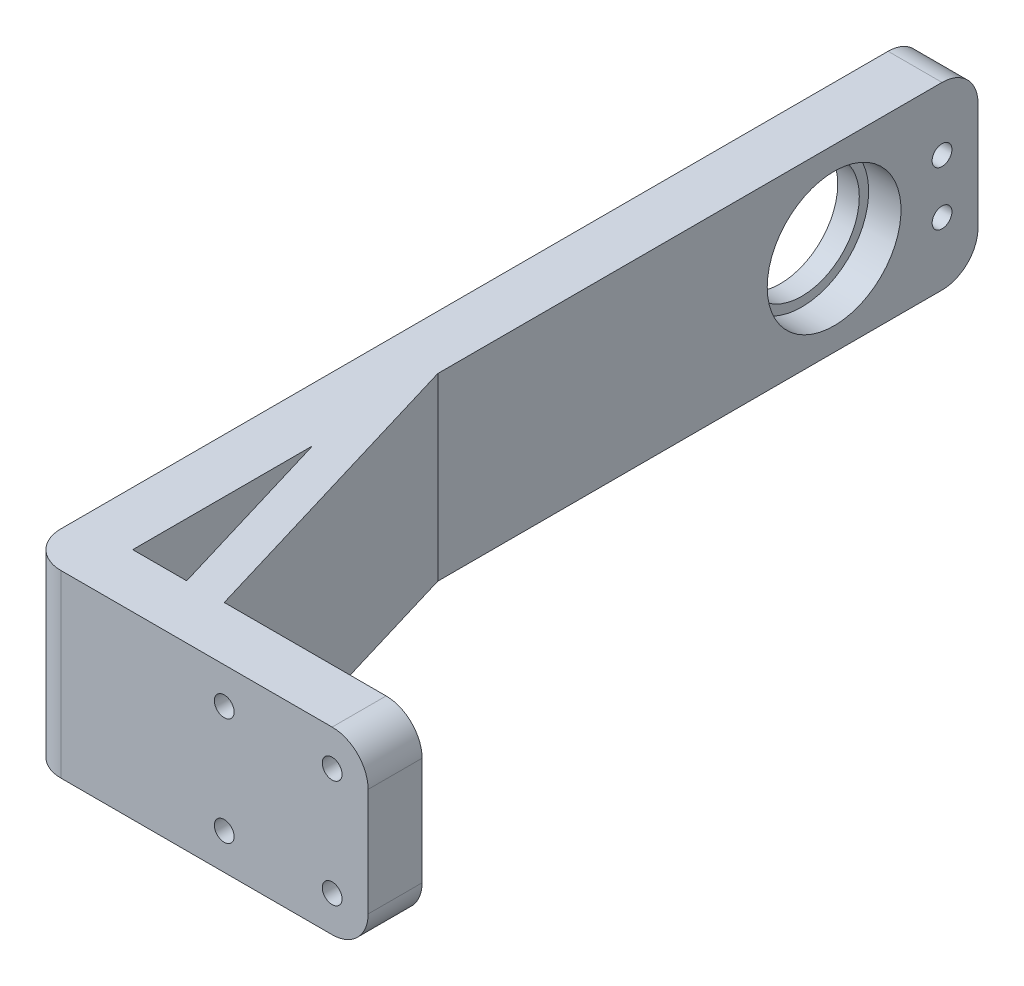
from build123d import *

# Parameters (mm, degrees)
BOSS_EXTRUDE1_DEPTH            = 50
SKETCH7_R                      = 16
CUT_EXTRUDE2_DEPTH             = 268.339938863
SKETCH8_R                      = 18.6
CUT_EXTRUDE3_DEPTH             = 9
FILLET2_R                      = 10
M5_CLEARANCE_HOLE2_D           = 5.5
M5_CLEARANCE_HOLE2_CSINK_D     = 5.55
M5_CLEARANCE_HOLE2_CSINK_ANGLE = 90
FILLET1_R                      = 10


# Read off the part's stored shape, not the designer's step: M5 Clearance Hole3
with BuildPart() as part:
    # Sketch1 → Boss-Extrude1 (new body)
    with BuildSketch(Plane(origin=(0, 0, 0), x_dir=(1, 0, 0), z_dir=(0, 1, 0))):
        Polygon((15, 15), (15, 250), (0, 250), (0, 0), (95.440306509, 0), (95.440306509, 15), align=None)
        Polygon((40.440306509, 15), (15, 99.801021696), (15, 65), (30, 15), align=None)
    extrude(amount=BOSS_EXTRUDE1_DEPTH)

    # Sketch7 → Cut-Extrude2 (cut, through all)
    with BuildSketch(Plane(origin=(15, 0, 0), x_dir=(0, 0, -1), z_dir=(1, 0, 0))):
        with Locations((210, 25)):
            Circle(SKETCH7_R)
    extrude(amount=-CUT_EXTRUDE2_DEPTH, mode=Mode.SUBTRACT)

    # Sketch8 → Cut-Extrude3 (cut)
    with BuildSketch(Plane.ZY.offset(-15)):
        with Locations((-210, 25)):
            Circle(SKETCH8_R)
    extrude(amount=CUT_EXTRUDE3_DEPTH, mode=Mode.SUBTRACT)

    # Fillet2
    fillet2_edges = [part.edges().sort_by_distance(p)[0] for p in [
        (0, 25, 0),
    ]]
    fillet(fillet2_edges, radius=FILLET2_R)

    # M5 Clearance Hole2 (through all)
    with Locations(Plane.ZY):
        with Locations((-240, 32.5), (-240, 17.5)):
            CounterSinkHole(M5_CLEARANCE_HOLE2_D / 2, M5_CLEARANCE_HOLE2_CSINK_D / 2, counter_sink_angle=M5_CLEARANCE_HOLE2_CSINK_ANGLE)

    # M5 Clearance Hole3 outline → M5 Clearance Hole3 (revolve, cut)
    with BuildSketch(Plane(origin=(55.440306509, 40, 0), x_dir=(1, 0, 0), z_dir=(0, -1, 0))):
        Polygon((2.75, -14.975), (2.75, 0), (0, 0), (0, -15), (2.775, -15), align=None)
    revolve(axis=Axis((55.440306509, 40, 0), (0, 0, 1)), mode=Mode.SUBTRACT)

    # M5 Clearance Hole3 2 outline → M5 Clearance Hole3 2 (revolve, cut)
    with BuildSketch(Plane(origin=(85.440306509, 10, 0), x_dir=(1, 0, 0), z_dir=(0, -1, 0))):
        Polygon((2.75, -14.975), (2.75, 0), (0, 0), (0, -15), (2.775, -15), align=None)
    revolve(axis=Axis((85.440306509, 10, 0), (0, 0, 1)), mode=Mode.SUBTRACT)

    # M5 Clearance Hole3 3 outline → M5 Clearance Hole3 3 (revolve, cut)
    with BuildSketch(Plane(origin=(55.440306509, 10, 0), x_dir=(1, 0, 0), z_dir=(0, -1, 0))):
        Polygon((2.75, -14.975), (2.75, 0), (0, 0), (0, -15), (2.775, -15), align=None)
    revolve(axis=Axis((55.440306509, 10, 0), (0, 0, 1)), mode=Mode.SUBTRACT)

    # M5 Clearance Hole3 4 outline → M5 Clearance Hole3 4 (revolve, cut)
    with BuildSketch(Plane(origin=(85.440306509, 40, 0), x_dir=(1, 0, 0), z_dir=(0, -1, 0))):
        Polygon((2.75, -14.975), (2.75, 0), (0, 0), (0, -15), (2.775, -15), align=None)
    revolve(axis=Axis((85.440306509, 40, 0), (0, 0, 1)), mode=Mode.SUBTRACT)

    # Fillet1
    fillet1_edges = [part.edges().sort_by_distance(p)[0] for p in [
        (95.440306509, 0, -7.5),
        (7.5, 0, -250),
        (7.5, 50, -250),
        (95.440306509, 50, -7.5),
    ]]
    fillet(fillet1_edges, radius=FILLET1_R)


solid = part.part
